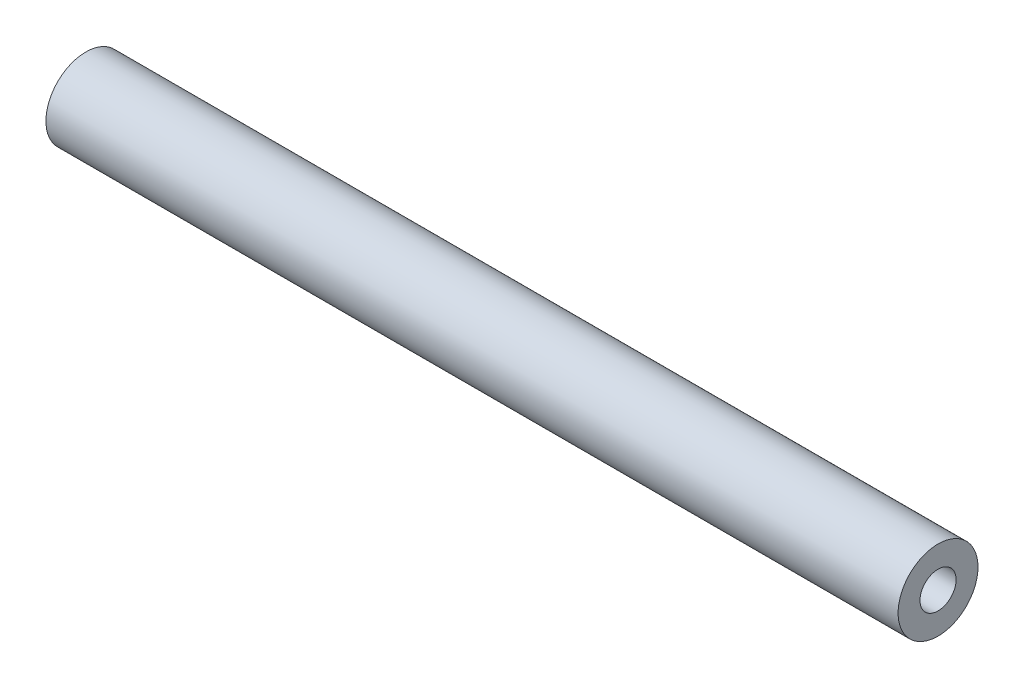
from build123d import *

# Parameters (mm, degrees)
SKETCH1_R           = 4.7625
SKETCH1_R_2         = 2.15265
BOSS_EXTRUDE1_DEPTH = 101.6


with BuildPart() as part:
    # Sketch1 → Boss-Extrude1 (new body)
    with BuildSketch(Plane(origin=(0, 0, 0), x_dir=(0, 0, -1), z_dir=(1, 0, 0))):
        Circle(SKETCH1_R)
        Circle(SKETCH1_R_2, mode=Mode.SUBTRACT)
    extrude(amount=BOSS_EXTRUDE1_DEPTH)


solid = part.part
